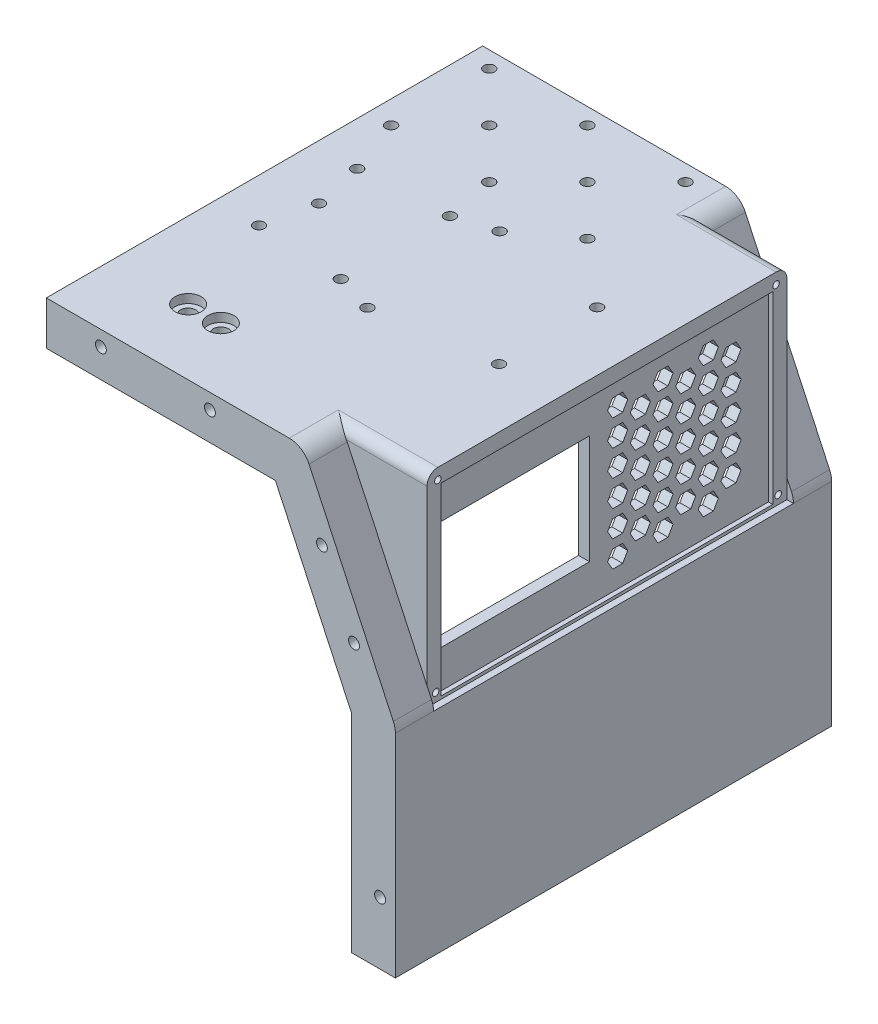
from build123d import *

# Parameters (mm, degrees)
EXTRUDE_2_DEPTH                  = 200
EXTRUDE_5_DEPTH                  = 80
CUT_EXTRUDE_6_DEPTH              = 339.378486482
SKETCH_13_W                      = 152
SKETCH_13_H                      = 84.5
CUT_EXTRUDE_7_DEPTH              = 5
CUT_EXTRUDE_8_REACH              = 352.999
SKETCH_14_W                      = 160
SKETCH_14_H                      = 10
SKETCH_21_R                      = 2.5
CUT_EXTRUDE_13_DEPTH             = 15
SKETCH_23_R                      = 2.5
CUT_EXTRUDE_14_DEPTH             = 10
CUT_EXTRUDE_15_REACH             = 306.959
SKETCH_24_R                      = 2.5
CUT_EXTRUDE_16_REACH             = 306.959
SKETCH_25_R                      = 3.5
CUT_EXTRUDE_16_DIRECTION_2_DEPTH = 305.959013748
SKETCH_26_R                      = 6
CUT_EXTRUDE_17_DEPTH             = 4
CUT_EXTRUDE_18_DEPTH             = 1
SKETCH_30_W                      = 39.666307972
SKETCH_30_H                      = 160
CUT_EXTRUDE_21_DEPTH             = 180
CUT_EXTRUDE_23_REACH             = 350.748
SKETCH_34_W                      = 70
SKETCH_34_H                      = 50
CUT_EXTRUDE_25_REACH             = 306.959
SKETCH_36_R                      = 2.5
CUT_EXTRUDE_26_REACH             = 306.959
SKETCH_37_R                      = 2.5
SKETCH_39_W                      = 152
SKETCH_39_H                      = 84.5
CUT_EXTRUDE_27_DEPTH             = 3
SKETCH_41_R                      = 1.5
CUT_EXTRUDE_28_DEPTH             = 10
CUT_EXTRUDE_29_DEPTH             = 10
CUT_EXTRUDE_30_REACH             = 350.748
OTHER_START                      = 120
OTHER_1_DEPTH                    = 5


# Read off the part's stored shape, not the designer's step: 填充阵列1
with BuildPart() as part:
    # 草图2 → 凸台-拉伸2 (new body)
    with BuildSketch(Plane.XY):
        with BuildLine():
            Line((90.430549088, 234.226182617), (129.06307787, 151.378457287))
            ThreePointArc((129.06307787, 151.378457287), (129.762960071, 149.316670809), (130, 147.15227467))
            Line((130, 147.15227467), (130, 50))
            Line((130, 50), (110, 50))
            Line((110, 50), (110, 144.935328043))
            Line((110, 144.935328043), (74.99676861, 220))
            Line((74.99676861, 220), (-30, 220))
            Line((-30, 220), (-30, 240))
            Line((-30, 240), (81.367471218, 240))
            ThreePointArc((81.367471218, 240), (86.740467301, 238.433914458), (90.430549088, 234.226182617))
        make_face()
    extrude(amount=EXTRUDE_2_DEPTH)

    # 草图11 → 凸台-拉伸5 (add)
    with BuildSketch(Plane(origin=(130, 0, 0), x_dir=(0, 0, -1), z_dir=(1, 0, 0))):
        with BuildLine():
            Line((-182.5, 146.894514051), (-17.5, 146.894514051))
            Line((-17.5, 146.894514051), (-17.5, 235))
            ThreePointArc((-17.5, 235), (-18.964466094, 238.535533906), (-22.5, 240))
            Line((-22.5, 240), (-177.5, 240))
            ThreePointArc((-177.5, 240), (-181.035533906, 238.535533906), (-182.5, 235))
            Line((-182.5, 235), (-182.5, 146.894514051))
        make_face()
    extrude(amount=-EXTRUDE_5_DEPTH)

    # 草图12 → 切除-拉伸6 (cut, through all)
    with BuildSketch(Plane(origin=(0, 0, 0), x_dir=(-1, 0, 0), z_dir=(0, 0, -1))):
        Polygon((-50, 220), (-74.99676861, 220), (-109.086416561, 146.894514051), (-50, 146.894514051), align=None)
    extrude(amount=-CUT_EXTRUDE_6_DEPTH, mode=Mode.SUBTRACT)

    # 草图13 → 切除-拉伸7 (cut)
    with BuildSketch(Plane(origin=(130, 0, 0), x_dir=(0, 0, -1), z_dir=(1, 0, 0))):
        with Locations((-100, 190.75)):
            Rectangle(SKETCH_13_W, SKETCH_13_H)
    extrude(amount=-CUT_EXTRUDE_7_DEPTH, mode=Mode.SUBTRACT)

    # 切除-拉伸8: up to this plane
    cut_extrude_8_end = Plane(origin=(74.99676861, 220, 200), z_dir=(0.9063077870366526, 0.42261826174069395, 0))
    # 草图14 → 切除-拉伸8 (cut, up to the surface)
    with BuildSketch(Plane.ZY.offset(30), mode=Mode.PRIVATE) as cut_extrude_8_sk1:
        with Locations((100, 225)):
            Rectangle(SKETCH_14_W, SKETCH_14_H)
    cut_extrude_8_tool1 = split(extrude(cut_extrude_8_sk1.sketch, amount=-CUT_EXTRUDE_8_REACH, mode=Mode.PRIVATE), bisect_by=cut_extrude_8_end, keep=Keep.BOTH, mode=Mode.PRIVATE)
    add(cut_extrude_8_tool1.solids().sort_by_distance((-30, 225, 100))[0], mode=Mode.SUBTRACT)

    # 草图21 → 切除-拉伸13 (cut)
    with BuildSketch(Plane(origin=(0, 0, 0), x_dir=(-1, 0, 0), z_dir=(0, 0, -1))):
        with Locations((5, 233)):
            Circle(SKETCH_21_R)
        with Locations((-45, 233)):
            Circle(SKETCH_21_R)
        with Locations((-96.335296429, 205)):
            Circle(SKETCH_21_R)
        with Locations((-111.038259994, 173.469392883)):
            Circle(SKETCH_21_R)
        with Locations((-123, 78.576137335)):
            Circle(SKETCH_21_R)
    cut_extrude_13 = extrude(amount=-CUT_EXTRUDE_13_DEPTH, mode=Mode.SUBTRACT)

    # 镜向1: 切除-拉伸13 across plane
    add(cut_extrude_13.mirror(Plane.XY.offset(100)), mode=Mode.SUBTRACT)

    # 草图23 → 切除-拉伸14 (cut)
    with BuildSketch(Plane(origin=(0, 240, 0), x_dir=(1, 0, 0), z_dir=(0, 1, 0))):
        with Locations(Location((100, -77.5, 0), (0, 0, 180))):
            Circle(SKETCH_23_R)
        with Locations(Location((100, -122.5, 0), (0, 0, 180))):
            Circle(SKETCH_23_R)
        with Locations(Location((30, -75, 0), (0, 0, 180))):
            Circle(SKETCH_23_R)
        with Locations(Location((30, -125, 0), (0, 0, 180))):
            Circle(SKETCH_23_R)
    extrude(amount=-CUT_EXTRUDE_14_DEPTH, mode=Mode.SUBTRACT)

    # 草图24 → 切除-拉伸15 (cut, up to next)
    with BuildSketch(Plane(origin=(0, 240, 0), x_dir=(1, 0, 0), z_dir=(0, 1, 0)), mode=Mode.PRIVATE) as cut_extrude_15_sk1:
        with Locations(Location((-5, -100, 0), (0, 0, 180))):
            Circle(SKETCH_24_R)
    cut_extrude_15_tool1 = extrude(cut_extrude_15_sk1.sketch, amount=-CUT_EXTRUDE_15_REACH, mode=Mode.PRIVATE) & part.part
    # 草图24 → 切除-拉伸15 (cut, up to next)
    with BuildSketch(Plane(origin=(0, 240, 0), x_dir=(1, 0, 0), z_dir=(0, 1, 0)), mode=Mode.PRIVATE) as cut_extrude_15_sk2:
        with Locations(Location((47.5, -69.689110868, 0), (0, 0, 180))):
            Circle(SKETCH_24_R)
    cut_extrude_15_tool2 = extrude(cut_extrude_15_sk2.sketch, amount=-CUT_EXTRUDE_15_REACH, mode=Mode.PRIVATE) & part.part
    # 草图24 → 切除-拉伸15 (cut, up to next)
    with BuildSketch(Plane(origin=(0, 240, 0), x_dir=(1, 0, 0), z_dir=(0, 1, 0)), mode=Mode.PRIVATE) as cut_extrude_15_sk3:
        with Locations(Location((47.5, -130.310889132, 0), (0, 0, 180))):
            Circle(SKETCH_24_R)
    cut_extrude_15_tool3 = extrude(cut_extrude_15_sk3.sketch, amount=-CUT_EXTRUDE_15_REACH, mode=Mode.PRIVATE) & part.part
    add(cut_extrude_15_tool1.solids().sort_by_distance((-5, 240, 100))[0], mode=Mode.SUBTRACT)
    add(cut_extrude_15_tool2.solids().sort_by_distance((47.5, 240, 69.689111))[0], mode=Mode.SUBTRACT)
    add(cut_extrude_15_tool3.solids().sort_by_distance((47.5, 240, 130.310889))[0], mode=Mode.SUBTRACT)

    # 草图25 → 切除-拉伸16 (cut, up to next)
    with BuildSketch(Plane(origin=(0, 240, 0), x_dir=(1, 0, 0), z_dir=(0, 1, 0)), mode=Mode.PRIVATE) as cut_extrude_16_sk1:
        with Locations((5, -170)):
            Circle(SKETCH_25_R)
    cut_extrude_16_tool1 = extrude(cut_extrude_16_sk1.sketch, amount=-CUT_EXTRUDE_16_REACH, mode=Mode.PRIVATE) & part.part
    # 草图25 → 切除-拉伸16 (cut, up to next)
    with BuildSketch(Plane(origin=(0, 240, 0), x_dir=(1, 0, 0), z_dir=(0, 1, 0)), mode=Mode.PRIVATE) as cut_extrude_16_sk2:
        with Locations((20, -170)):
            Circle(SKETCH_25_R)
    cut_extrude_16_tool2 = extrude(cut_extrude_16_sk2.sketch, amount=-CUT_EXTRUDE_16_REACH, mode=Mode.PRIVATE) & part.part
    add(cut_extrude_16_tool1.solids().sort_by_distance((5, 240, 170))[0], mode=Mode.SUBTRACT)
    add(cut_extrude_16_tool2.solids().sort_by_distance((20, 240, 170))[0], mode=Mode.SUBTRACT)

    # 草图25 → 切除-拉伸16 direction 2 (cut)
    with BuildSketch(Plane(origin=(0, 240, 0), x_dir=(1, 0, 0), z_dir=(0, 1, 0))):
        with Locations((5, -170)):
            Circle(SKETCH_25_R)
        with Locations((20, -170)):
            Circle(SKETCH_25_R)
    extrude(amount=CUT_EXTRUDE_16_DIRECTION_2_DEPTH, mode=Mode.SUBTRACT)

    # 草图26 → 切除-拉伸17 (cut)
    with BuildSketch(Plane(origin=(0, 240, 0), x_dir=(1, 0, 0), z_dir=(0, 1, 0))):
        with Locations(Location((5, -170, 0), (0, 0, 180))):
            Circle(SKETCH_26_R)
        with Locations(Location((20, -170, 0), (0, 0, 180))):
            Circle(SKETCH_26_R)
    extrude(amount=-CUT_EXTRUDE_17_DEPTH, mode=Mode.SUBTRACT)

    # 草图27 → 切除-拉伸18 (cut)
    with BuildSketch(Plane.XZ.offset(-230)):
        Polygon((9.618802154, 170), (7.309401077, 174), (2.690598923, 174), (0.381197846, 170), (2.690598923, 166), (7.309401077, 166), align=None)
        Polygon((24.618802154, 170), (22.309401077, 174), (17.690598923, 174), (15.381197846, 170), (17.690598923, 166), (22.309401077, 166), align=None)
    extrude(amount=-CUT_EXTRUDE_18_DEPTH, mode=Mode.SUBTRACT)

    # 草图30 → 切除-拉伸21 (cut)
    with BuildSketch(Plane.XZ.offset(-230)):
        with Locations((90.166846014, 100)):
            Rectangle(SKETCH_30_W, SKETCH_30_H)
    extrude(amount=CUT_EXTRUDE_21_DEPTH, mode=Mode.SUBTRACT)

    # 草图34 → 切除-拉伸23 (cut, up to next)
    with BuildSketch(Plane(origin=(125, 0, 0), x_dir=(0, 0, -1), z_dir=(1, 0, 0)), mode=Mode.PRIVATE) as cut_extrude_23_sk1:
        with Locations((-141, 190.75)):
            Rectangle(SKETCH_34_W, SKETCH_34_H)
    cut_extrude_23_tool1 = extrude(cut_extrude_23_sk1.sketch, amount=-CUT_EXTRUDE_23_REACH, mode=Mode.PRIVATE) & part.part
    add(cut_extrude_23_tool1.solids().sort_by_distance((125, 190.75, 141))[0], mode=Mode.SUBTRACT)

    # 草图36 → 切除-拉伸25 (cut, up to next)
    with BuildSketch(Plane(origin=(0, 240, 0), x_dir=(1, 0, 0), z_dir=(0, 1, 0)), mode=Mode.PRIVATE) as cut_extrude_25_sk1:
        with Locations(Location((-10, -77.5, 0), (0, 0, 180))):
            Circle(SKETCH_36_R)
    cut_extrude_25_tool1 = extrude(cut_extrude_25_sk1.sketch, amount=-CUT_EXTRUDE_25_REACH, mode=Mode.PRIVATE) & part.part
    # 草图36 → 切除-拉伸25 (cut, up to next)
    with BuildSketch(Plane(origin=(0, 240, 0), x_dir=(1, 0, 0), z_dir=(0, 1, 0)), mode=Mode.PRIVATE) as cut_extrude_25_sk2:
        with Locations(Location((-10, -122.5, 0), (0, 0, 180))):
            Circle(SKETCH_36_R)
    cut_extrude_25_tool2 = extrude(cut_extrude_25_sk2.sketch, amount=-CUT_EXTRUDE_25_REACH, mode=Mode.PRIVATE) & part.part
    add(cut_extrude_25_tool1.solids().sort_by_distance((-10, 240, 77.5))[0], mode=Mode.SUBTRACT)
    add(cut_extrude_25_tool2.solids().sort_by_distance((-10, 240, 122.5))[0], mode=Mode.SUBTRACT)

    # 草图37 → 切除-拉伸26 (cut, up to next)
    with BuildSketch(Plane(origin=(0, 240, 0), x_dir=(1, 0, 0), z_dir=(0, 1, 0)), mode=Mode.PRIVATE) as cut_extrude_26_sk1:
        with Locations(Location((48.030531969, -30, 0), (0, 0, 180))):
            Circle(SKETCH_37_R)
    cut_extrude_26_tool1 = extrude(cut_extrude_26_sk1.sketch, amount=-CUT_EXTRUDE_26_REACH, mode=Mode.PRIVATE) & part.part
    # 草图37 → 切除-拉伸26 (cut, up to next)
    with BuildSketch(Plane(origin=(0, 240, 0), x_dir=(1, 0, 0), z_dir=(0, 1, 0)), mode=Mode.PRIVATE) as cut_extrude_26_sk2:
        with Locations(Location((3.030531969, -30, 0), (0, 0, 180))):
            Circle(SKETCH_37_R)
    cut_extrude_26_tool2 = extrude(cut_extrude_26_sk2.sketch, amount=-CUT_EXTRUDE_26_REACH, mode=Mode.PRIVATE) & part.part
    # 草图37 → 切除-拉伸26 (cut, up to next)
    with BuildSketch(Plane(origin=(0, 240, 0), x_dir=(1, 0, 0), z_dir=(0, 1, 0)), mode=Mode.PRIVATE) as cut_extrude_26_sk3:
        with Locations(Location((25.530531969, -52.5, 0), (0, 0, 180))):
            Circle(SKETCH_37_R)
    cut_extrude_26_tool3 = extrude(cut_extrude_26_sk3.sketch, amount=-CUT_EXTRUDE_26_REACH, mode=Mode.PRIVATE) & part.part
    # 草图37 → 切除-拉伸26 (cut, up to next)
    with BuildSketch(Plane(origin=(0, 240, 0), x_dir=(1, 0, 0), z_dir=(0, 1, 0)), mode=Mode.PRIVATE) as cut_extrude_26_sk4:
        with Locations(Location((25.530531969, -7.5, 0), (0, 0, 180))):
            Circle(SKETCH_37_R)
    cut_extrude_26_tool4 = extrude(cut_extrude_26_sk4.sketch, amount=-CUT_EXTRUDE_26_REACH, mode=Mode.PRIVATE) & part.part
    # 草图37 → 切除-拉伸26 (cut, up to next)
    with BuildSketch(Plane(origin=(0, 240, 0), x_dir=(1, 0, 0), z_dir=(0, 1, 0)), mode=Mode.PRIVATE) as cut_extrude_26_sk5:
        with Locations(Location((70.530531969, -7.5, 0), (0, 0, 180))):
            Circle(SKETCH_37_R)
    cut_extrude_26_tool5 = extrude(cut_extrude_26_sk5.sketch, amount=-CUT_EXTRUDE_26_REACH, mode=Mode.PRIVATE) & part.part
    # 草图37 → 切除-拉伸26 (cut, up to next)
    with BuildSketch(Plane(origin=(0, 240, 0), x_dir=(1, 0, 0), z_dir=(0, 1, 0)), mode=Mode.PRIVATE) as cut_extrude_26_sk6:
        with Locations(Location((70.530531969, -52.5, 0), (0, 0, 180))):
            Circle(SKETCH_37_R)
    cut_extrude_26_tool6 = extrude(cut_extrude_26_sk6.sketch, amount=-CUT_EXTRUDE_26_REACH, mode=Mode.PRIVATE) & part.part
    # 草图37 → 切除-拉伸26 (cut, up to next)
    with BuildSketch(Plane(origin=(0, 240, 0), x_dir=(1, 0, 0), z_dir=(0, 1, 0)), mode=Mode.PRIVATE) as cut_extrude_26_sk7:
        with Locations(Location((-19.469468031, -52.5, 0), (0, 0, 180))):
            Circle(SKETCH_37_R)
    cut_extrude_26_tool7 = extrude(cut_extrude_26_sk7.sketch, amount=-CUT_EXTRUDE_26_REACH, mode=Mode.PRIVATE) & part.part
    # 草图37 → 切除-拉伸26 (cut, up to next)
    with BuildSketch(Plane(origin=(0, 240, 0), x_dir=(1, 0, 0), z_dir=(0, 1, 0)), mode=Mode.PRIVATE) as cut_extrude_26_sk8:
        with Locations(Location((-19.469468031, -7.5, 0), (0, 0, 270))):
            Circle(SKETCH_37_R)
    cut_extrude_26_tool8 = extrude(cut_extrude_26_sk8.sketch, amount=-CUT_EXTRUDE_26_REACH, mode=Mode.PRIVATE) & part.part
    add(cut_extrude_26_tool1.solids().sort_by_distance((48.030532, 240, 30))[0], mode=Mode.SUBTRACT)
    add(cut_extrude_26_tool2.solids().sort_by_distance((3.030532, 240, 30))[0], mode=Mode.SUBTRACT)
    add(cut_extrude_26_tool3.solids().sort_by_distance((25.530532, 240, 52.5))[0], mode=Mode.SUBTRACT)
    add(cut_extrude_26_tool4.solids().sort_by_distance((25.530532, 240, 7.5))[0], mode=Mode.SUBTRACT)
    add(cut_extrude_26_tool5.solids().sort_by_distance((70.530532, 240, 7.5))[0], mode=Mode.SUBTRACT)
    add(cut_extrude_26_tool6.solids().sort_by_distance((70.530532, 240, 52.5))[0], mode=Mode.SUBTRACT)
    add(cut_extrude_26_tool7.solids().sort_by_distance((-19.469468, 240, 52.5))[0], mode=Mode.SUBTRACT)
    add(cut_extrude_26_tool8.solids().sort_by_distance((-19.469468, 240, 7.5))[0], mode=Mode.SUBTRACT)

    # 草图39 → 切除-拉伸27 (cut)
    # profile 1 of 2: a face of its own
    with BuildSketch(Plane(origin=(130, 0, 0), x_dir=(0, 0, -1), z_dir=(1, 0, 0))):
        with BuildLine():
            Line((-182.5, 147.15227467), (-17.5, 147.15227467))
            Line((-17.5, 147.15227467), (-17.5, 235))
            ThreePointArc((-17.5, 235), (-18.964466094, 238.535533906), (-22.5, 240))
            Line((-22.5, 240), (-177.5, 240))
            ThreePointArc((-177.5, 240), (-181.035533906, 238.535533906), (-182.5, 235))
            Line((-182.5, 235), (-182.5, 147.15227467))
        make_face()
        with Locations((-100, 190.75)):
            Rectangle(SKETCH_39_W, SKETCH_39_H, mode=Mode.SUBTRACT)
    # profile 2 of 2: a face of its own
    with BuildSketch(Plane(origin=(130, 0, 0), x_dir=(0, 0, -1), z_dir=(1, 0, 0))):
        with Locations((-100, 190.75)):
            Rectangle(SKETCH_39_W, SKETCH_39_H)
    extrude(amount=-CUT_EXTRUDE_27_DEPTH, mode=Mode.SUBTRACT)

    # 草图41 → 切除-拉伸28 (cut)
    with BuildSketch(Plane(origin=(127, 0, 0), x_dir=(0, 0, -1), z_dir=(1, 0, 0))):
        with Locations((-177.5, 235)):
            Circle(SKETCH_41_R)
        with Locations((-22.5, 235)):
            Circle(SKETCH_41_R)
        with Locations((-21.5, 151.15227467)):
            Circle(SKETCH_41_R)
        with Locations((-178.5, 151.15227467)):
            Circle(SKETCH_41_R)
    extrude(amount=-CUT_EXTRUDE_28_DEPTH, mode=Mode.SUBTRACT)

    # 草图42 → 切除-拉伸29 (cut)
    with BuildSketch(Plane.ZY.offset(-110)):
        Polygon((20, 144.935328043), (20, 50), (180, 50), (180, 144.935328043), (180, 230), (20, 230), align=None)
    extrude(amount=-CUT_EXTRUDE_29_DEPTH, mode=Mode.SUBTRACT)

    # 草图43 → 切除-拉伸30 (cut, up to next)
    with BuildSketch(Plane(origin=(125, 0, 0), x_dir=(0, 0, -1), z_dir=(1, 0, 0)), mode=Mode.PRIVATE) as cut_extrude_30_sk1:
        Polygon((-57.304454469, 191.496104329), (-59.613855545, 195.496104329), (-64.232657699, 195.496104329), (-66.542058776, 191.496104329), (-64.232657699, 187.496104329), (-59.613855545, 187.496104329), align=None)
    cut_extrude_30_tool1 = extrude(cut_extrude_30_sk1.sketch, amount=-CUT_EXTRUDE_30_REACH, mode=Mode.PRIVATE) & part.part
    add(cut_extrude_30_tool1.solids().sort_by_distance((125, 191.496104, 61.923257))[0], mode=Mode.SUBTRACT)

    # 填充阵列1 outline → 填充阵列1 (cut)
    with BuildSketch(Plane.YZ.offset(OTHER_START)):
        Polygon((205.496104329, 53.840352853), (205.496104329, 49.2215507), (209.496104329, 46.912149623), (213.496104329, 49.2215507), (213.496104329, 53.840352853), (209.496104329, 56.14975393), align=None)
        Polygon((169.496104329, 74.624962544), (169.496104329, 70.006160391), (173.496104329, 67.696759314), (177.496104329, 70.006160391), (177.496104329, 74.624962544), (173.496104329, 76.934363621), align=None)
        Polygon((191.496104329, 87.326668466), (187.496104329, 85.01726739), (187.496104329, 80.398465236), (191.496104329, 78.089064159), (195.496104329, 80.398465236), (195.496104329, 85.01726739), align=None)
        Polygon((191.496104329, 45.757449085), (187.496104329, 43.448048008), (187.496104329, 38.829245855), (191.496104329, 36.519844778), (195.496104329, 38.829245855), (195.496104329, 43.448048008), align=None)
        Polygon((213.496104329, 74.624962544), (209.496104329, 76.934363621), (205.496104329, 74.624962544), (205.496104329, 70.006160391), (209.496104329, 67.696759314), (213.496104329, 70.006160391), align=None)
        Polygon((177.496104329, 53.840352853), (173.496104329, 56.14975393), (169.496104329, 53.840352853), (169.496104329, 49.2215507), (173.496104329, 46.912149623), (177.496104329, 49.2215507), align=None)
        Polygon((157.496104329, 53.840352853), (157.496104329, 49.2215507), (161.496104329, 46.912149623), (165.496104329, 49.2215507), (165.496104329, 53.840352853), (161.496104329, 56.14975393), align=None)
        Polygon((175.496104329, 43.448048008), (175.496104329, 38.829245855), (179.496104329, 36.519844778), (183.496104329, 38.829245855), (183.496104329, 43.448048008), (179.496104329, 45.757449085), align=None)
        Polygon((161.496104329, 97.718973312), (157.496104329, 95.409572235), (157.496104329, 90.790770082), (161.496104329, 88.481369005), (165.496104329, 90.790770082), (165.496104329, 95.409572235), align=None)
        Polygon((161.496104329, 76.934363621), (157.496104329, 74.624962544), (157.496104329, 70.006160391), (161.496104329, 67.696759314), (165.496104329, 70.006160391), (165.496104329, 74.624962544), align=None)
        Polygon((201.496104329, 74.624962544), (197.496104329, 76.934363621), (193.496104329, 74.624962544), (193.496104329, 70.006160391), (197.496104329, 67.696759314), (201.496104329, 70.006160391), align=None)
        Polygon((219.496104329, 85.01726739), (215.496104329, 87.326668466), (211.496104329, 85.01726739), (211.496104329, 80.398465236), (215.496104329, 78.089064159), (219.496104329, 80.398465236), align=None)
        Polygon((183.496104329, 64.232657699), (179.496104329, 66.542058776), (175.496104329, 64.232657699), (175.496104329, 59.613855545), (179.496104329, 57.304454469), (183.496104329, 59.613855545), align=None)
        Polygon((199.496104329, 85.01726739), (199.496104329, 80.398465236), (203.496104329, 78.089064159), (207.496104329, 80.398465236), (207.496104329, 85.01726739), (203.496104329, 87.326668466), align=None)
        Polygon((181.496104329, 95.409572235), (181.496104329, 90.790770082), (185.496104329, 88.481369005), (189.496104329, 90.790770082), (189.496104329, 95.409572235), (185.496104329, 97.718973312), align=None)
        Polygon((217.496104329, 74.624962544), (217.496104329, 70.006160391), (221.496104329, 67.696759314), (225.496104329, 70.006160391), (225.496104329, 74.624962544), (221.496104329, 76.934363621), align=None)
        Polygon((203.496104329, 66.542058776), (199.496104329, 64.232657699), (199.496104329, 59.613855545), (203.496104329, 57.304454469), (207.496104329, 59.613855545), (207.496104329, 64.232657699), align=None)
        Polygon((203.496104329, 45.757449085), (199.496104329, 43.448048008), (199.496104329, 38.829245855), (203.496104329, 36.519844778), (207.496104329, 38.829245855), (207.496104329, 43.448048008), align=None)
        Polygon((225.496104329, 95.409572235), (221.496104329, 97.718973312), (217.496104329, 95.409572235), (217.496104329, 90.790770082), (221.496104329, 88.481369005), (225.496104329, 90.790770082), align=None)
        Polygon((171.496104329, 64.232657699), (167.496104329, 66.542058776), (163.496104329, 64.232657699), (163.496104329, 59.613855545), (167.496104329, 57.304454469), (171.496104329, 59.613855545), align=None)
        Polygon((189.496104329, 74.624962544), (185.496104329, 76.934363621), (181.496104329, 74.624962544), (181.496104329, 70.006160391), (185.496104329, 67.696759314), (189.496104329, 70.006160391), align=None)
        Polygon((193.496104329, 95.409572235), (193.496104329, 90.790770082), (197.496104329, 88.481369005), (201.496104329, 90.790770082), (201.496104329, 95.409572235), (197.496104329, 97.718973312), align=None)
        Polygon((197.496104329, 56.14975393), (193.496104329, 53.840352853), (193.496104329, 49.2215507), (197.496104329, 46.912149623), (201.496104329, 49.2215507), (201.496104329, 53.840352853), align=None)
        Polygon((183.496104329, 85.01726739), (179.496104329, 87.326668466), (175.496104329, 85.01726739), (175.496104329, 80.398465236), (179.496104329, 78.089064159), (183.496104329, 80.398465236), align=None)
        Polygon((211.496104329, 43.448048008), (211.496104329, 38.829245855), (215.496104329, 36.519844778), (219.496104329, 38.829245855), (219.496104329, 43.448048008), (215.496104329, 45.757449085), align=None)
        Polygon((215.496104329, 66.542058776), (211.496104329, 64.232657699), (211.496104329, 59.613855545), (215.496104329, 57.304454469), (219.496104329, 59.613855545), (219.496104329, 64.232657699), align=None)
        Polygon((209.496104329, 97.718973312), (205.496104329, 95.409572235), (205.496104329, 90.790770082), (209.496104329, 88.481369005), (213.496104329, 90.790770082), (213.496104329, 95.409572235), align=None)
        Polygon((217.496104329, 53.840352853), (217.496104329, 49.2215507), (221.496104329, 46.912149623), (225.496104329, 49.2215507), (225.496104329, 53.840352853), (221.496104329, 56.14975393), align=None)
        Polygon((163.496104329, 85.01726739), (163.496104329, 80.398465236), (167.496104329, 78.089064159), (171.496104329, 80.398465236), (171.496104329, 85.01726739), (167.496104329, 87.326668466), align=None)
        Polygon((171.496104329, 43.448048008), (167.496104329, 45.757449085), (163.496104329, 43.448048008), (163.496104329, 38.829245855), (167.496104329, 36.519844778), (171.496104329, 38.829245855), align=None)
        Polygon((189.496104329, 53.840352853), (185.496104329, 56.14975393), (181.496104329, 53.840352853), (181.496104329, 49.2215507), (185.496104329, 46.912149623), (189.496104329, 49.2215507), align=None)
        Polygon((169.496104329, 95.409572235), (169.496104329, 90.790770082), (173.496104329, 88.481369005), (177.496104329, 90.790770082), (177.496104329, 95.409572235), (173.496104329, 97.718973312), align=None)
    extrude(amount=OTHER_1_DEPTH, mode=Mode.SUBTRACT)


solid = part.part
